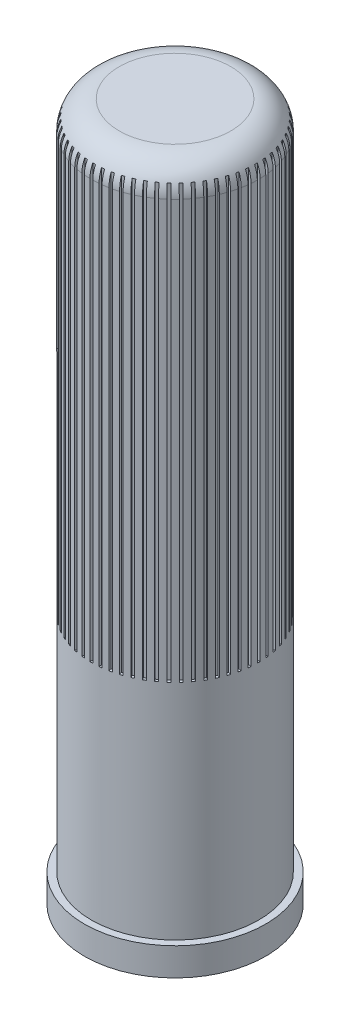
from build123d import *

# Parameters (mm, degrees)
SKETCH1_R           = 3.25
BOSS_EXTRUDE1_DEPTH = 25
SKETCH2_R           = 4.56645513
SKETCH2_R_2         = 3
CUT_EXTRUDE1_DEPTH  = 24
FILLET1_R           = 1
CUT_EXTRUDE2_DEPTH  = 16


with BuildPart() as part:
    # Sketch1 → Boss-Extrude1 (new body)
    with BuildSketch(Plane(origin=(0, 0, 0), x_dir=(1, 0, 0), z_dir=(0, 1, 0))):
        Circle(SKETCH1_R)
    extrude(amount=BOSS_EXTRUDE1_DEPTH)

    # Sketch2 → Cut-Extrude1 (cut)
    with BuildSketch(Plane(origin=(0, 25, 0), x_dir=(1, 0, 0), z_dir=(0, 1, 0))):
        Circle(SKETCH2_R)
        Circle(SKETCH2_R_2, mode=Mode.SUBTRACT)
    extrude(amount=-CUT_EXTRUDE1_DEPTH, mode=Mode.SUBTRACT)

    # Fillet1
    fillet1_edges = [part.edges().sort_by_distance(p)[0] for p in [
        (-3, 25, 0),
    ]]
    fillet(fillet1_edges, radius=FILLET1_R)

    # Sketch3 → Cut-Extrude2 (cut)
    with BuildSketch(Plane(origin=(0, 25, 0), x_dir=(1, 0, 0), z_dir=(0, 1, 0))):
        with BuildLine():
            Line((-0.05, 2.9), (0.05, 2.9))
            Line((0.05, 2.9), (0.05, 2.999583304))
            ThreePointArc((0.05, 2.999583304), (0, 3), (-0.05, 2.999583304))
            Line((-0.05, 2.999583304), (-0.05, 2.9))
        make_face()
        with BuildLine():
            Line((0.253406449, 2.88933992), (0.352858638, 2.878887073))
            Line((0.352858638, 2.878887073), (0.363267928, 2.97792485))
            ThreePointArc((0.363267928, 2.97792485), (0.31358539, 2.983565686), (0.263815738, 2.988377696))
            Line((0.263815738, 2.988377696), (0.253406449, 2.88933992))
        make_face()
        with BuildLine():
            Line((0.554036523, 2.847023627), (0.651851283, 2.826232458))
            Line((0.651851283, 2.826232458), (0.672555817, 2.923639628))
            ThreePointArc((0.672555817, 2.923639628), (0.623735072, 2.934442802), (0.574741057, 2.944430797))
            Line((0.574741057, 2.944430797), (0.554036523, 2.847023627))
        make_face()
        with BuildLine():
            Line((0.848596458, 2.773514747), (0.94370211, 2.742613048))
            Line((0.94370211, 2.742613048), (0.974475043, 2.837322398))
            ThreePointArc((0.974475043, 2.837322398), (0.927050983, 2.853169549), (0.879369391, 2.868224098))
            Line((0.879369391, 2.868224098), (0.848596458, 2.773514747))
        make_face()
        with BuildLine():
            Line((1.133858992, 2.669618659), (1.225213538, 2.628944995))
            Line((1.225213538, 2.628944995), (1.265717717, 2.71991887))
            ThreePointArc((1.265717717, 2.71991887), (1.220209929, 2.740636373), (1.174363171, 2.760592535))
            Line((1.174363171, 2.760592535), (1.133858992, 2.669618659))
        make_face()
        with BuildLine():
            Line((1.40669873, 2.536473671), (1.49330127, 2.486473671))
            Line((1.49330127, 2.486473671), (1.543092922, 2.572715342))
            ThreePointArc((1.543092922, 2.572715342), (1.5, 2.598076211), (1.456490382, 2.622715342))
            Line((1.456490382, 2.622715342), (1.40669873, 2.536473671))
        make_face()
        with BuildLine():
            Line((1.664126382, 2.375538546), (1.745028081, 2.316760021))
            Line((1.745028081, 2.316760021), (1.803561679, 2.397324607))
            ThreePointArc((1.803561679, 2.397324607), (1.763355757, 2.427050983), (1.72265998, 2.456103132))
            Line((1.72265998, 2.456103132), (1.664126382, 2.375538546))
        make_face()
        with BuildLine():
            Line((1.903321517, 2.188576524), (1.977636, 2.121663464))
            Line((1.977636, 2.121663464), (2.044270237, 2.195668281))
            ThreePointArc((2.044270237, 2.195668281), (2.007391819, 2.229434476), (1.969955754, 2.262581342))
            Line((1.969955754, 2.262581342), (1.903321517, 2.188576524))
        make_face()
        with BuildLine():
            Line((2.121663464, 1.977636), (2.188576524, 1.903321517))
            Line((2.188576524, 1.903321517), (2.262581342, 1.969955754))
            ThreePointArc((2.262581342, 1.969955754), (2.229434476, 2.007391819), (2.195668281, 2.044270237))
            Line((2.195668281, 2.044270237), (2.121663464, 1.977636))
        make_face()
        with BuildLine():
            Line((2.316760021, 1.745028081), (2.375538546, 1.664126382))
            Line((2.375538546, 1.664126382), (2.456103132, 1.72265998))
            ThreePointArc((2.456103132, 1.72265998), (2.427050983, 1.763355757), (2.397324607, 1.803561679))
            Line((2.397324607, 1.803561679), (2.316760021, 1.745028081))
        make_face()
        with BuildLine():
            Line((2.486473671, 1.49330127), (2.536473671, 1.40669873))
            Line((2.536473671, 1.40669873), (2.622715342, 1.456490382))
            ThreePointArc((2.622715342, 1.456490382), (2.598076211, 1.5), (2.572715342, 1.543092922))
            Line((2.572715342, 1.543092922), (2.486473671, 1.49330127))
        make_face()
        with BuildLine():
            Line((2.628944995, 1.225213538), (2.669618659, 1.133858992))
            Line((2.669618659, 1.133858992), (2.760592535, 1.174363171))
            ThreePointArc((2.760592535, 1.174363171), (2.740636373, 1.220209929), (2.71991887, 1.265717717))
            Line((2.71991887, 1.265717717), (2.628944995, 1.225213538))
        make_face()
        with BuildLine():
            Line((2.742613048, 0.94370211), (2.773514747, 0.848596458))
            Line((2.773514747, 0.848596458), (2.868224098, 0.879369391))
            ThreePointArc((2.868224098, 0.879369391), (2.853169549, 0.927050983), (2.837322398, 0.974475043))
            Line((2.837322398, 0.974475043), (2.742613048, 0.94370211))
        make_face()
        with BuildLine():
            Line((2.826232458, 0.651851283), (2.847023627, 0.554036523))
            Line((2.847023627, 0.554036523), (2.944430797, 0.574741057))
            ThreePointArc((2.944430797, 0.574741057), (2.934442802, 0.623735072), (2.923639628, 0.672555817))
            Line((2.923639628, 0.672555817), (2.826232458, 0.651851283))
        make_face()
        with BuildLine():
            Line((2.878887073, 0.352858638), (2.88933992, 0.253406449))
            Line((2.88933992, 0.253406449), (2.988377696, 0.263815738))
            ThreePointArc((2.988377696, 0.263815738), (2.983565686, 0.31358539), (2.97792485, 0.363267928))
            Line((2.97792485, 0.363267928), (2.878887073, 0.352858638))
        make_face()
        with BuildLine():
            Line((2.9, 0.05), (2.9, -0.05))
            Line((2.9, -0.05), (2.999583304, -0.05))
            ThreePointArc((2.999583304, -0.05), (3, 0), (2.999583304, 0.05))
            Line((2.999583304, 0.05), (2.9, 0.05))
        make_face()
        with BuildLine():
            Line((2.88933992, -0.253406449), (2.878887073, -0.352858638))
            Line((2.878887073, -0.352858638), (2.97792485, -0.363267928))
            ThreePointArc((2.97792485, -0.363267928), (2.983565686, -0.31358539), (2.988377696, -0.263815738))
            Line((2.988377696, -0.263815738), (2.88933992, -0.253406449))
        make_face()
        with BuildLine():
            Line((2.847023627, -0.554036523), (2.826232458, -0.651851283))
            Line((2.826232458, -0.651851283), (2.923639628, -0.672555817))
            ThreePointArc((2.923639628, -0.672555817), (2.934442802, -0.623735072), (2.944430797, -0.574741057))
            Line((2.944430797, -0.574741057), (2.847023627, -0.554036523))
        make_face()
        with BuildLine():
            Line((2.773514747, -0.848596458), (2.742613048, -0.94370211))
            Line((2.742613048, -0.94370211), (2.837322398, -0.974475043))
            ThreePointArc((2.837322398, -0.974475043), (2.853169549, -0.927050983), (2.868224098, -0.879369391))
            Line((2.868224098, -0.879369391), (2.773514747, -0.848596458))
        make_face()
        with BuildLine():
            Line((2.669618659, -1.133858992), (2.628944995, -1.225213538))
            Line((2.628944995, -1.225213538), (2.71991887, -1.265717717))
            ThreePointArc((2.71991887, -1.265717717), (2.740636373, -1.220209929), (2.760592535, -1.174363171))
            Line((2.760592535, -1.174363171), (2.669618659, -1.133858992))
        make_face()
        with BuildLine():
            Line((2.536473671, -1.40669873), (2.486473671, -1.49330127))
            Line((2.486473671, -1.49330127), (2.572715342, -1.543092922))
            ThreePointArc((2.572715342, -1.543092922), (2.598076211, -1.5), (2.622715342, -1.456490382))
            Line((2.622715342, -1.456490382), (2.536473671, -1.40669873))
        make_face()
        with BuildLine():
            Line((2.375538546, -1.664126382), (2.316760021, -1.745028081))
            Line((2.316760021, -1.745028081), (2.397324607, -1.803561679))
            ThreePointArc((2.397324607, -1.803561679), (2.427050983, -1.763355757), (2.456103132, -1.72265998))
            Line((2.456103132, -1.72265998), (2.375538546, -1.664126382))
        make_face()
        with BuildLine():
            Line((2.188576524, -1.903321517), (2.121663464, -1.977636))
            Line((2.121663464, -1.977636), (2.195668281, -2.044270237))
            ThreePointArc((2.195668281, -2.044270237), (2.229434476, -2.007391819), (2.262581342, -1.969955754))
            Line((2.262581342, -1.969955754), (2.188576524, -1.903321517))
        make_face()
        with BuildLine():
            Line((1.977636, -2.121663464), (1.903321517, -2.188576524))
            Line((1.903321517, -2.188576524), (1.969955754, -2.262581342))
            ThreePointArc((1.969955754, -2.262581342), (2.007391819, -2.229434476), (2.044270237, -2.195668281))
            Line((2.044270237, -2.195668281), (1.977636, -2.121663464))
        make_face()
        with BuildLine():
            Line((1.745028081, -2.316760021), (1.664126382, -2.375538546))
            Line((1.664126382, -2.375538546), (1.72265998, -2.456103132))
            ThreePointArc((1.72265998, -2.456103132), (1.763355757, -2.427050983), (1.803561679, -2.397324607))
            Line((1.803561679, -2.397324607), (1.745028081, -2.316760021))
        make_face()
        with BuildLine():
            Line((1.49330127, -2.486473671), (1.40669873, -2.536473671))
            Line((1.40669873, -2.536473671), (1.456490382, -2.622715342))
            ThreePointArc((1.456490382, -2.622715342), (1.5, -2.598076211), (1.543092922, -2.572715342))
            Line((1.543092922, -2.572715342), (1.49330127, -2.486473671))
        make_face()
        with BuildLine():
            Line((1.225213538, -2.628944995), (1.133858992, -2.669618659))
            Line((1.133858992, -2.669618659), (1.174363171, -2.760592535))
            ThreePointArc((1.174363171, -2.760592535), (1.220209929, -2.740636373), (1.265717717, -2.71991887))
            Line((1.265717717, -2.71991887), (1.225213538, -2.628944995))
        make_face()
        with BuildLine():
            Line((0.94370211, -2.742613048), (0.848596458, -2.773514747))
            Line((0.848596458, -2.773514747), (0.879369391, -2.868224098))
            ThreePointArc((0.879369391, -2.868224098), (0.927050983, -2.853169549), (0.974475043, -2.837322398))
            Line((0.974475043, -2.837322398), (0.94370211, -2.742613048))
        make_face()
        with BuildLine():
            Line((0.651851283, -2.826232458), (0.554036523, -2.847023627))
            Line((0.554036523, -2.847023627), (0.574741057, -2.944430797))
            ThreePointArc((0.574741057, -2.944430797), (0.623735072, -2.934442802), (0.672555817, -2.923639628))
            Line((0.672555817, -2.923639628), (0.651851283, -2.826232458))
        make_face()
        with BuildLine():
            Line((0.352858638, -2.878887073), (0.253406449, -2.88933992))
            Line((0.253406449, -2.88933992), (0.263815738, -2.988377696))
            ThreePointArc((0.263815738, -2.988377696), (0.31358539, -2.983565686), (0.363267928, -2.97792485))
            Line((0.363267928, -2.97792485), (0.352858638, -2.878887073))
        make_face()
        with BuildLine():
            Line((0.05, -2.9), (-0.05, -2.9))
            Line((-0.05, -2.9), (-0.05, -2.999583304))
            ThreePointArc((-0.05, -2.999583304), (0, -3), (0.05, -2.999583304))
            Line((0.05, -2.999583304), (0.05, -2.9))
        make_face()
        with BuildLine():
            Line((-0.253406449, -2.88933992), (-0.352858638, -2.878887073))
            Line((-0.352858638, -2.878887073), (-0.363267928, -2.97792485))
            ThreePointArc((-0.363267928, -2.97792485), (-0.31358539, -2.983565686), (-0.263815738, -2.988377696))
            Line((-0.263815738, -2.988377696), (-0.253406449, -2.88933992))
        make_face()
        with BuildLine():
            Line((-0.554036523, -2.847023627), (-0.651851283, -2.826232458))
            Line((-0.651851283, -2.826232458), (-0.672555817, -2.923639628))
            ThreePointArc((-0.672555817, -2.923639628), (-0.623735072, -2.934442802), (-0.574741057, -2.944430797))
            Line((-0.574741057, -2.944430797), (-0.554036523, -2.847023627))
        make_face()
        with BuildLine():
            Line((-0.848596458, -2.773514747), (-0.94370211, -2.742613048))
            Line((-0.94370211, -2.742613048), (-0.974475043, -2.837322398))
            ThreePointArc((-0.974475043, -2.837322398), (-0.927050983, -2.853169549), (-0.879369391, -2.868224098))
            Line((-0.879369391, -2.868224098), (-0.848596458, -2.773514747))
        make_face()
        with BuildLine():
            Line((-1.133858992, -2.669618659), (-1.225213538, -2.628944995))
            Line((-1.225213538, -2.628944995), (-1.265717717, -2.71991887))
            ThreePointArc((-1.265717717, -2.71991887), (-1.220209929, -2.740636373), (-1.174363171, -2.760592535))
            Line((-1.174363171, -2.760592535), (-1.133858992, -2.669618659))
        make_face()
        with BuildLine():
            Line((-1.40669873, -2.536473671), (-1.49330127, -2.486473671))
            Line((-1.49330127, -2.486473671), (-1.543092922, -2.572715342))
            ThreePointArc((-1.543092922, -2.572715342), (-1.5, -2.598076211), (-1.456490382, -2.622715342))
            Line((-1.456490382, -2.622715342), (-1.40669873, -2.536473671))
        make_face()
        with BuildLine():
            Line((-1.664126382, -2.375538546), (-1.745028081, -2.316760021))
            Line((-1.745028081, -2.316760021), (-1.803561679, -2.397324607))
            ThreePointArc((-1.803561679, -2.397324607), (-1.763355757, -2.427050983), (-1.72265998, -2.456103132))
            Line((-1.72265998, -2.456103132), (-1.664126382, -2.375538546))
        make_face()
        with BuildLine():
            Line((-1.903321517, -2.188576524), (-1.977636, -2.121663464))
            Line((-1.977636, -2.121663464), (-2.044270237, -2.195668281))
            ThreePointArc((-2.044270237, -2.195668281), (-2.007391819, -2.229434476), (-1.969955754, -2.262581342))
            Line((-1.969955754, -2.262581342), (-1.903321517, -2.188576524))
        make_face()
        with BuildLine():
            Line((-2.121663464, -1.977636), (-2.188576524, -1.903321517))
            Line((-2.188576524, -1.903321517), (-2.262581342, -1.969955754))
            ThreePointArc((-2.262581342, -1.969955754), (-2.229434476, -2.007391819), (-2.195668281, -2.044270237))
            Line((-2.195668281, -2.044270237), (-2.121663464, -1.977636))
        make_face()
        with BuildLine():
            Line((-2.316760021, -1.745028081), (-2.375538546, -1.664126382))
            Line((-2.375538546, -1.664126382), (-2.456103132, -1.72265998))
            ThreePointArc((-2.456103132, -1.72265998), (-2.427050983, -1.763355757), (-2.397324607, -1.803561679))
            Line((-2.397324607, -1.803561679), (-2.316760021, -1.745028081))
        make_face()
        with BuildLine():
            Line((-2.486473671, -1.49330127), (-2.536473671, -1.40669873))
            Line((-2.536473671, -1.40669873), (-2.622715342, -1.456490382))
            ThreePointArc((-2.622715342, -1.456490382), (-2.598076211, -1.5), (-2.572715342, -1.543092922))
            Line((-2.572715342, -1.543092922), (-2.486473671, -1.49330127))
        make_face()
        with BuildLine():
            Line((-2.628944995, -1.225213538), (-2.669618659, -1.133858992))
            Line((-2.669618659, -1.133858992), (-2.760592535, -1.174363171))
            ThreePointArc((-2.760592535, -1.174363171), (-2.740636373, -1.220209929), (-2.71991887, -1.265717717))
            Line((-2.71991887, -1.265717717), (-2.628944995, -1.225213538))
        make_face()
        with BuildLine():
            Line((-2.742613048, -0.94370211), (-2.773514747, -0.848596458))
            Line((-2.773514747, -0.848596458), (-2.868224098, -0.879369391))
            ThreePointArc((-2.868224098, -0.879369391), (-2.853169549, -0.927050983), (-2.837322398, -0.974475043))
            Line((-2.837322398, -0.974475043), (-2.742613048, -0.94370211))
        make_face()
        with BuildLine():
            Line((-2.826232458, -0.651851283), (-2.847023627, -0.554036523))
            Line((-2.847023627, -0.554036523), (-2.944430797, -0.574741057))
            ThreePointArc((-2.944430797, -0.574741057), (-2.934442802, -0.623735072), (-2.923639628, -0.672555817))
            Line((-2.923639628, -0.672555817), (-2.826232458, -0.651851283))
        make_face()
        with BuildLine():
            Line((-2.878887073, -0.352858638), (-2.88933992, -0.253406449))
            Line((-2.88933992, -0.253406449), (-2.988377696, -0.263815738))
            ThreePointArc((-2.988377696, -0.263815738), (-2.983565686, -0.31358539), (-2.97792485, -0.363267928))
            Line((-2.97792485, -0.363267928), (-2.878887073, -0.352858638))
        make_face()
        with BuildLine():
            Line((-2.9, -0.05), (-2.9, 0.05))
            Line((-2.9, 0.05), (-2.999583304, 0.05))
            ThreePointArc((-2.999583304, 0.05), (-3, 0), (-2.999583304, -0.05))
            Line((-2.999583304, -0.05), (-2.9, -0.05))
        make_face()
        with BuildLine():
            Line((-2.88933992, 0.253406449), (-2.878887073, 0.352858638))
            Line((-2.878887073, 0.352858638), (-2.97792485, 0.363267928))
            ThreePointArc((-2.97792485, 0.363267928), (-2.983565686, 0.31358539), (-2.988377696, 0.263815738))
            Line((-2.988377696, 0.263815738), (-2.88933992, 0.253406449))
        make_face()
        with BuildLine():
            Line((-2.847023627, 0.554036523), (-2.826232458, 0.651851283))
            Line((-2.826232458, 0.651851283), (-2.923639628, 0.672555817))
            ThreePointArc((-2.923639628, 0.672555817), (-2.934442802, 0.623735072), (-2.944430797, 0.574741057))
            Line((-2.944430797, 0.574741057), (-2.847023627, 0.554036523))
        make_face()
        with BuildLine():
            Line((-2.773514747, 0.848596458), (-2.742613048, 0.94370211))
            Line((-2.742613048, 0.94370211), (-2.837322398, 0.974475043))
            ThreePointArc((-2.837322398, 0.974475043), (-2.853169549, 0.927050983), (-2.868224098, 0.879369391))
            Line((-2.868224098, 0.879369391), (-2.773514747, 0.848596458))
        make_face()
        with BuildLine():
            Line((-2.669618659, 1.133858992), (-2.628944995, 1.225213538))
            Line((-2.628944995, 1.225213538), (-2.71991887, 1.265717717))
            ThreePointArc((-2.71991887, 1.265717717), (-2.740636373, 1.220209929), (-2.760592535, 1.174363171))
            Line((-2.760592535, 1.174363171), (-2.669618659, 1.133858992))
        make_face()
        with BuildLine():
            Line((-2.536473671, 1.40669873), (-2.486473671, 1.49330127))
            Line((-2.486473671, 1.49330127), (-2.572715342, 1.543092922))
            ThreePointArc((-2.572715342, 1.543092922), (-2.598076211, 1.5), (-2.622715342, 1.456490382))
            Line((-2.622715342, 1.456490382), (-2.536473671, 1.40669873))
        make_face()
        with BuildLine():
            Line((-2.375538546, 1.664126382), (-2.316760021, 1.745028081))
            Line((-2.316760021, 1.745028081), (-2.397324607, 1.803561679))
            ThreePointArc((-2.397324607, 1.803561679), (-2.427050983, 1.763355757), (-2.456103132, 1.72265998))
            Line((-2.456103132, 1.72265998), (-2.375538546, 1.664126382))
        make_face()
        with BuildLine():
            Line((-2.188576524, 1.903321517), (-2.121663464, 1.977636))
            Line((-2.121663464, 1.977636), (-2.195668281, 2.044270237))
            ThreePointArc((-2.195668281, 2.044270237), (-2.229434476, 2.007391819), (-2.262581342, 1.969955754))
            Line((-2.262581342, 1.969955754), (-2.188576524, 1.903321517))
        make_face()
        with BuildLine():
            Line((-1.977636, 2.121663464), (-1.903321517, 2.188576524))
            Line((-1.903321517, 2.188576524), (-1.969955754, 2.262581342))
            ThreePointArc((-1.969955754, 2.262581342), (-2.007391819, 2.229434476), (-2.044270237, 2.195668281))
            Line((-2.044270237, 2.195668281), (-1.977636, 2.121663464))
        make_face()
        with BuildLine():
            Line((-1.745028081, 2.316760021), (-1.664126382, 2.375538546))
            Line((-1.664126382, 2.375538546), (-1.72265998, 2.456103132))
            ThreePointArc((-1.72265998, 2.456103132), (-1.763355757, 2.427050983), (-1.803561679, 2.397324607))
            Line((-1.803561679, 2.397324607), (-1.745028081, 2.316760021))
        make_face()
        with BuildLine():
            Line((-1.49330127, 2.486473671), (-1.40669873, 2.536473671))
            Line((-1.40669873, 2.536473671), (-1.456490382, 2.622715342))
            ThreePointArc((-1.456490382, 2.622715342), (-1.5, 2.598076211), (-1.543092922, 2.572715342))
            Line((-1.543092922, 2.572715342), (-1.49330127, 2.486473671))
        make_face()
        with BuildLine():
            Line((-1.225213538, 2.628944995), (-1.133858992, 2.669618659))
            Line((-1.133858992, 2.669618659), (-1.174363171, 2.760592535))
            ThreePointArc((-1.174363171, 2.760592535), (-1.220209929, 2.740636373), (-1.265717717, 2.71991887))
            Line((-1.265717717, 2.71991887), (-1.225213538, 2.628944995))
        make_face()
        with BuildLine():
            Line((-0.94370211, 2.742613048), (-0.848596458, 2.773514747))
            Line((-0.848596458, 2.773514747), (-0.879369391, 2.868224098))
            ThreePointArc((-0.879369391, 2.868224098), (-0.927050983, 2.853169549), (-0.974475043, 2.837322398))
            Line((-0.974475043, 2.837322398), (-0.94370211, 2.742613048))
        make_face()
        with BuildLine():
            Line((-0.651851283, 2.826232458), (-0.554036523, 2.847023627))
            Line((-0.554036523, 2.847023627), (-0.574741057, 2.944430797))
            ThreePointArc((-0.574741057, 2.944430797), (-0.623735072, 2.934442802), (-0.672555817, 2.923639628))
            Line((-0.672555817, 2.923639628), (-0.651851283, 2.826232458))
        make_face()
        with BuildLine():
            Line((-0.352858638, 2.878887073), (-0.253406449, 2.88933992))
            Line((-0.253406449, 2.88933992), (-0.263815738, 2.988377696))
            ThreePointArc((-0.263815738, 2.988377696), (-0.31358539, 2.983565686), (-0.363267928, 2.97792485))
            Line((-0.363267928, 2.97792485), (-0.352858638, 2.878887073))
        make_face()
    extrude(amount=-CUT_EXTRUDE2_DEPTH, mode=Mode.SUBTRACT)


solid = part.part
